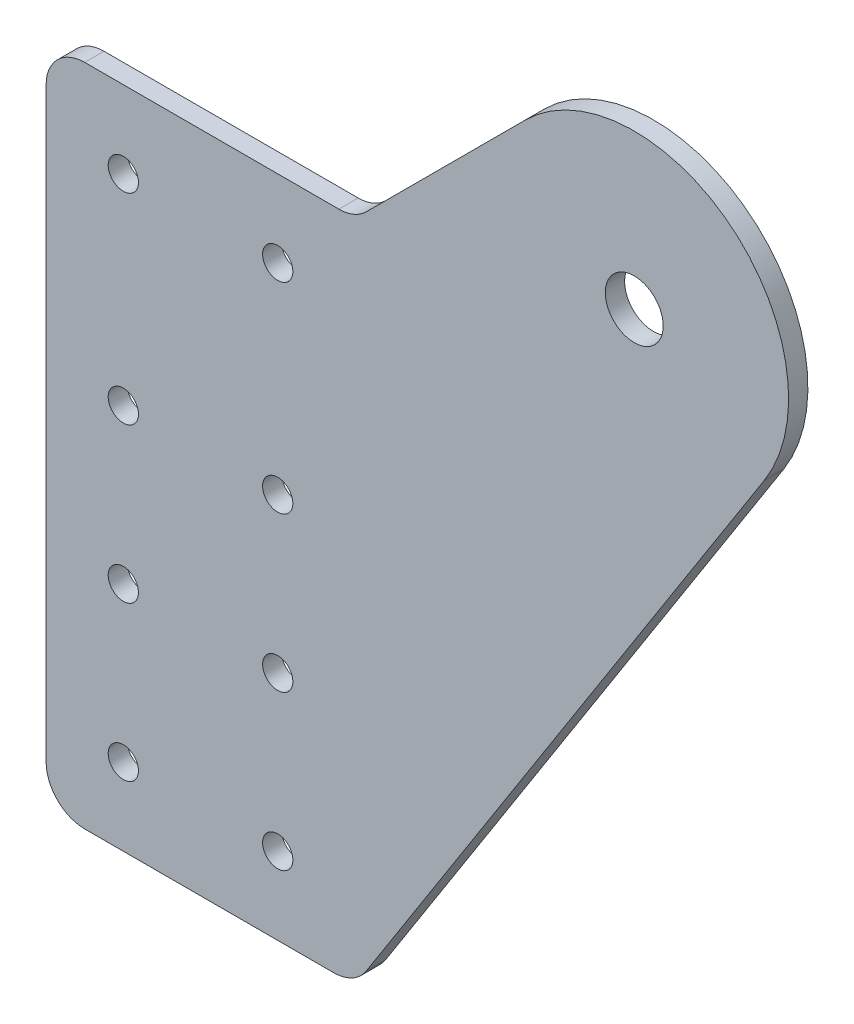
from build123d import *

# Parameters (mm, degrees)
SKETCH2_R           = 4.7625
BOSS_EXTRUDE1_DEPTH = 3.175
SKETCH3_R           = 2.4892
CUT_EXTRUDE1_DEPTH  = 190.356866458
FILLET1_R           = 6.35


with BuildPart() as part:
    # Sketch2 → Boss-Extrude1 (new body)
    with BuildSketch(Plane.XY):
        with BuildLine():
            Line((50.8, 109.22), (78.793223912, 137.213223912))
            ThreePointArc((78.793223912, 137.213223912), (112.658719111, 139.05653749), (118.166879838, 105.591186222))
            Line((118.166879838, 105.591186222), (50.8, 0))
            Line((50.8, 0), (0, 0))
            Line((0, 0), (0, 109.22))
            Line((0, 109.22), (50.8, 109.22))
        make_face()
        with Locations((96.753736154, 119.252711669)):
            Circle(SKETCH2_R, mode=Mode.SUBTRACT)
    extrude(amount=-BOSS_EXTRUDE1_DEPTH)

    # Sketch3 → Cut-Extrude1 (cut, through all)
    with BuildSketch(Plane.XY):
        with Locations((12.7, 96.52)):
            Circle(SKETCH3_R)
        with Locations((38.1, 96.52)):
            Circle(SKETCH3_R)
        with Locations((12.7, 63.5)):
            Circle(SKETCH3_R)
        with Locations((12.7, 38.1)):
            Circle(SKETCH3_R)
        with Locations((12.7, 12.7)):
            Circle(SKETCH3_R)
        with Locations((12.7, -12.7)):
            Circle(SKETCH3_R)
        with Locations((12.7, -38.1)):
            Circle(SKETCH3_R)
        with Locations((38.1, 38.1)):
            Circle(SKETCH3_R)
        with Locations((38.1, 12.7)):
            Circle(SKETCH3_R)
        with Locations((38.1, -12.7)):
            Circle(SKETCH3_R)
        with Locations((38.1, -38.1)):
            Circle(SKETCH3_R)
        with Locations((38.1, 63.5)):
            Circle(SKETCH3_R)
    extrude(amount=-CUT_EXTRUDE1_DEPTH, mode=Mode.SUBTRACT)

    # Fillet1
    fillet1_edges = [part.edges().sort_by_distance(p)[0] for p in [
        (0, 0, -1.5875),
        (50.8, 0, -1.5875),
        (50.8, 109.22, -1.5875),
        (0, 109.22, -1.5875),
    ]]
    fillet(fillet1_edges, radius=FILLET1_R)


solid = part.part
